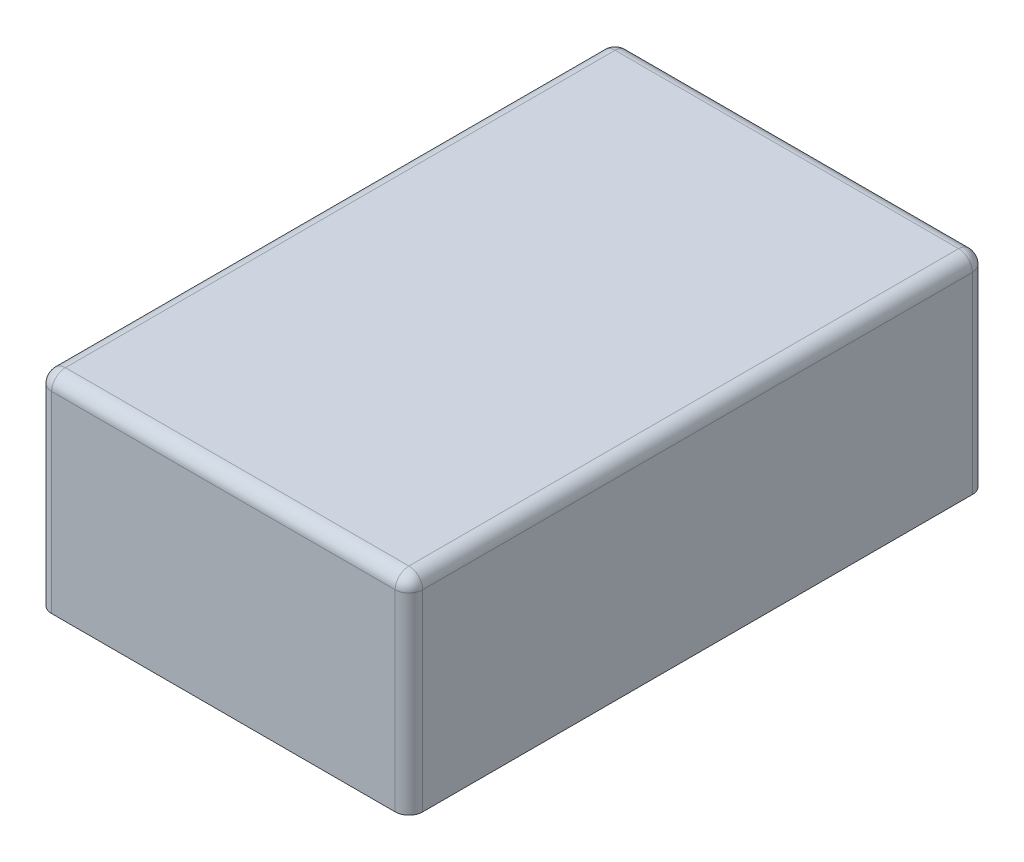
from build123d import *

# Parameters (mm, degrees)
SKETCH_1_W          = 27
SKETCH_1_H          = 42
EXTRUDE_1_DEPTH     = 15
SKETCH_4_W          = 25
SKETCH_4_H          = 40
CUT_EXTRUDE_1_DEPTH = 14
FILLET_1_R          = 1
FILLET_3_R          = 1


with BuildPart() as part:
    # ｽｹｯﾁ1 → ﾎﾞｽ - 押し出し1 (new body)
    with BuildSketch(Plane(origin=(0, 0, 0), x_dir=(1, 0, 0), z_dir=(0, 1, 0))):
        with Locations((-52.257137385, 8.704647457)):
            Rectangle(SKETCH_1_W, SKETCH_1_H)
    extrude(amount=EXTRUDE_1_DEPTH)

    # ｽｹｯﾁ4 → ｶｯﾄ - 押し出し1 (cut)
    with BuildSketch(Plane(origin=(0, 0, 0), x_dir=(1, 0, 0), z_dir=(0, 1, 0))):
        with Locations((-52.257137385, 8.704647457)):
            Rectangle(SKETCH_4_W, SKETCH_4_H)
    extrude(amount=CUT_EXTRUDE_1_DEPTH, mode=Mode.SUBTRACT)

    # ﾌｨﾚｯﾄ1
    fillet_1_edges = [part.edges().sort_by_distance(p)[0] for p in [
        (-38.757137385, 15, -8.704647457),
        (-52.257137385, 15, -29.704647457),
        (-65.757137385, 15, -8.704647457),
        (-52.257137385, 15, 12.295352543),
    ]]
    fillet(fillet_1_edges, radius=FILLET_1_R)

    # ﾌｨﾚｯﾄ3
    # the kernel refuses this fillet: 1 mm, written as the material it takes off along each edge
    with BuildSketch(Plane(origin=(-39.757137385, 14, 11.295352543), x_dir=(0, 0, 1), z_dir=(1, 0, 0))) as fillet_3_piece_1_section:
        Polygon((0, 0), (FILLET_3_R, 0), (FILLET_3_R, -FILLET_3_R), (0, -FILLET_3_R), align=None)
    fillet_3_piece_1 = extrude(amount=FILLET_3_R, mode=Mode.PRIVATE)
    fillet_3_piece_1 = fillet_3_piece_1 - Plane(origin=(-39.757137385, 14, 11.295352543), x_dir=(0, -0.7071067811865475, -0.7071067811865475), z_dir=(1, 0, 0)) * Sphere(FILLET_3_R, mode=Mode.PRIVATE)
    add(fillet_3_piece_1, mode=Mode.SUBTRACT)
    with BuildSketch(Plane(origin=(-64.757137385, 14, 11.295352543), x_dir=(0, 0, 1), z_dir=(-1, 0, 0))) as fillet_3_piece_2_section:
        Polygon((0, 0), (FILLET_3_R, 0), (FILLET_3_R, FILLET_3_R), (0, FILLET_3_R), align=None)
    fillet_3_piece_2 = extrude(amount=FILLET_3_R, mode=Mode.PRIVATE)
    fillet_3_piece_2 = fillet_3_piece_2 - Plane(origin=(-64.757137385, 14, 11.295352543), x_dir=(0, -0.7071067811865475, -0.7071067811865475), z_dir=(-1, 0, 0)) * Sphere(FILLET_3_R, mode=Mode.PRIVATE)
    add(fillet_3_piece_2, mode=Mode.SUBTRACT)
    with BuildSketch(Plane(origin=(-39.757137385, 14, -28.704647457), x_dir=(1, 0, 0), z_dir=(0, 0, -1))) as fillet_3_piece_3_section:
        Polygon((0, 0), (FILLET_3_R, 0), (FILLET_3_R, -FILLET_3_R), (0, -FILLET_3_R), align=None)
    fillet_3_piece_3 = extrude(amount=FILLET_3_R, mode=Mode.PRIVATE)
    fillet_3_piece_3 = fillet_3_piece_3 - Plane(origin=(-39.757137385, 14, -28.704647457), x_dir=(-0.7071067811865475, -0.7071067811865475, 0), z_dir=(0, 0, -1)) * Sphere(FILLET_3_R, mode=Mode.PRIVATE)
    add(fillet_3_piece_3, mode=Mode.SUBTRACT)
    with BuildSketch(Plane(origin=(-64.757137385, 14, -28.704647457), x_dir=(-1, 0, 0), z_dir=(0, 0, -1))) as fillet_3_piece_4_section:
        Polygon((0, 0), (FILLET_3_R, 0), (FILLET_3_R, FILLET_3_R), (0, FILLET_3_R), align=None)
    fillet_3_piece_4 = extrude(amount=FILLET_3_R, mode=Mode.PRIVATE)
    fillet_3_piece_4 = fillet_3_piece_4 - Plane(origin=(-64.757137385, 14, -28.704647457), x_dir=(0.7071067811865475, -0.7071067811865475, 0), z_dir=(0, 0, -1)) * Sphere(FILLET_3_R, mode=Mode.PRIVATE)
    add(fillet_3_piece_4, mode=Mode.SUBTRACT)
    with BuildSketch(Plane(origin=(-65.757137385, -2.5, -29.704647457), x_dir=(1, 0, 0), z_dir=(0, 1, 0)), Plane(origin=(-65.757137385, -2.5, 12.295352543), x_dir=(0, 0, -1), z_dir=(0, 1, 0))) as fillet_3_piece_5:
        with BuildLine():
            CenterArc((FILLET_3_R, -FILLET_3_R), FILLET_3_R, 90, 90)
            Line((0, -FILLET_3_R), (0, 0))
            Line((0, 0), (FILLET_3_R, 0))
        make_face()
    extrude(amount=16.5, mode=Mode.SUBTRACT)
    with BuildSketch(Plane(origin=(-38.757137385, -2.5, -29.704647457), x_dir=(-1, 0, 0), z_dir=(0, 1, 0)), Plane(origin=(-38.757137385, -2.5, 12.295352543), x_dir=(0, 0, -1), z_dir=(0, 1, 0))) as fillet_3_piece_6:
        with BuildLine():
            CenterArc((FILLET_3_R, FILLET_3_R), FILLET_3_R, 180, 90)
            Line((0, FILLET_3_R), (0, 0))
            Line((0, 0), (FILLET_3_R, 0))
        make_face()
    extrude(amount=16.5, mode=Mode.SUBTRACT)


solid = part.part
